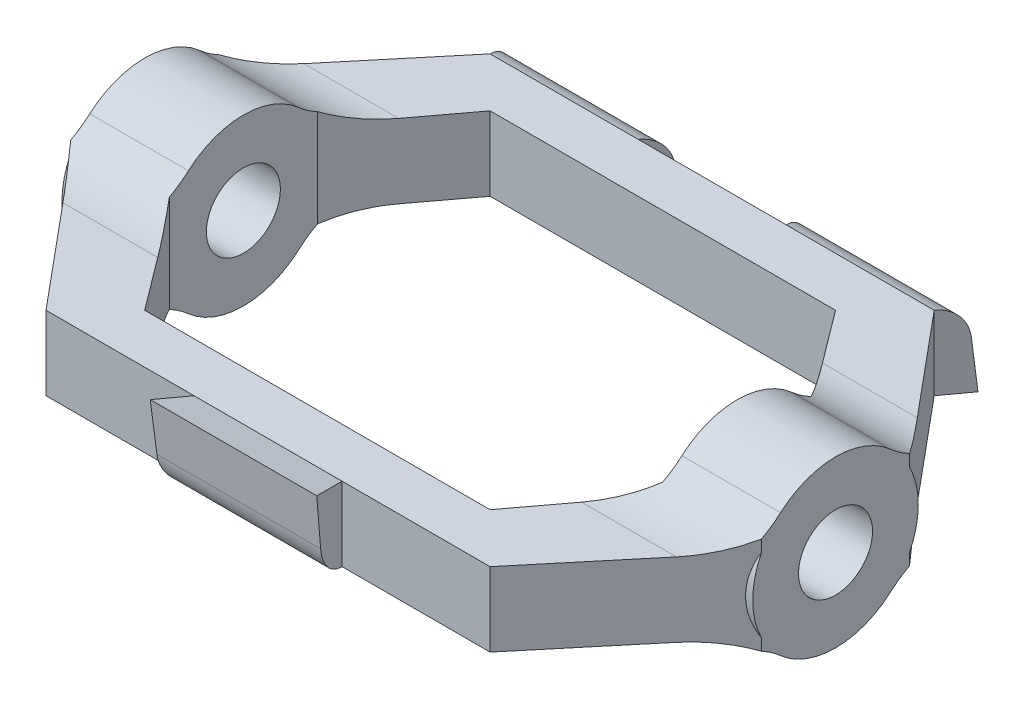
from build123d import *

# Parameters (mm, degrees)
RESSALTO_EXTRUS_O1_DEPTH           = 7.5
RESSALTO_EXTRUS_O1_2_DEPTH         = 7.5
ESBO_O2_R                          = 16.770509831
ESBO_O2_R_2                        = 7.5
RESSALTO_EXTRUS_O2_DEPTH           = 20
FILETE1_R                          = 20
ESBO_O3_W                          = 30
ESBO_O3_H                          = 15
RESSALTO_EXTRUS_O3_DEPTH           = 7
RESSALTO_EXTRUS_O3_DRAFT           = -15
ESBO_O4_W                          = 30
ESBO_O4_H                          = 15
RESSALTO_EXTRUS_O4_DEPTH           = 7
RESSALTO_EXTRUS_O4_DRAFT           = -15
RESSALTO_EXTRUS_O4_PROFILE_2_DEPTH = 7
RESSALTO_EXTRUS_O4_PROFILE_2_DRAFT = -15
CORTE_EXTRUS_O1_DEPTH              = 16.88
CORTE_EXTRUS_O2_DEPTH              = 46.88
FILETE4_R                          = 8


with BuildPart() as part:
    # Esboço1 → Ressalto-extrusão1 (new, symmetric)
    with BuildSketch(Plane(origin=(0, 0, 0), x_dir=(1, 0, 0), z_dir=(0, 1, 0))):
        Polygon((45, -45), (70, -15), (50, -15), (35, -35), (-35, -35), (-50, -15), (-70, -15), (-45, -45), align=None)
    extrude(amount=RESSALTO_EXTRUS_O1_DEPTH, both=True)



with BuildPart() as body_2:
    # Esboço1 → Ressalto-extrus_o1 2 (new, symmetric)
    with BuildSketch(Plane(origin=(0, 0, 0), x_dir=(1, 0, 0), z_dir=(0, 1, 0))):
        Polygon((70, 15), (50, 15), (35, 35), (-35, 35), (-50, 15), (-70, 15), (-45, 45), (45, 45), align=None)
    extrude(amount=RESSALTO_EXTRUS_O1_2_DEPTH, both=True)


with BuildPart() as part_1:
    add(part.part)

    add(body_2.part)  # Ressalto-extrusão2 merges body 2
    # Esboço2 → Ressalto-extrusão2 (add)
    with BuildSketch(Plane(origin=(-50, 0, 0), x_dir=(0, 0, -1), z_dir=(1, 0, 0))):
        Circle(ESBO_O2_R)
        Circle(ESBO_O2_R_2, mode=Mode.SUBTRACT)
    ressalto_extrus_o2 = extrude(amount=-RESSALTO_EXTRUS_O2_DEPTH)

    # Espelhar1: Ressalto-extrusão2 across plane
    add(ressalto_extrus_o2.mirror(Plane(origin=(0, 0, 0), x_dir=(0, 0, 1), z_dir=(1, 0, 0))))

    # Filete1
    # the kernel refuses this fillet: 20 mm, written as the material it adds along each edge
    with BuildSketch(Plane(origin=(70, -7.5, 15), x_dir=(0, 0, 1), z_dir=(-1, 0, 0))) as filete1_piece_1_section:
        with BuildLine():
            CenterArc((9.409432465, -20), FILETE1_R, 90, 41.59276394)
            ThreePointArc((-3.867202848, -5.042361324), (-1.692591399, -2.706021572), (0, 0))
            Line((0, 0), (9.409432465, 0))
        make_face()
    filete1_piece_1 = extrude(amount=20, mode=Mode.PRIVATE)
    filete1_piece_1 = split(filete1_piece_1, bisect_by=Plane(origin=(64.976467601, -8.579836869, 21.028238879), z_dir=(-0.7682212795973759, 0, -0.6401843996644799)), keep=Keep.TOP, mode=Mode.PRIVATE)
    filete1_piece_1 = split(filete1_piece_1, bisect_by=Plane(origin=(52.72088695, -8.579836869, 11.372150733), z_dir=(0.7999999999999996, 0, 0.6000000000000005)), keep=Keep.TOP, mode=Mode.PRIVATE)
    add(filete1_piece_1)
    with BuildSketch(Plane(origin=(70, -7.5, 15), x_dir=(0, 0, 1), z_dir=(-1, 0, 0))) as filete1_piece_2_section:
        with BuildLine():
            CenterArc((9.409432465, -20), FILETE1_R, 90, 41.59276394)
            ThreePointArc((-3.867202848, -5.042361324), (-1.692591399, -2.706021572), (0, 0))
            Line((0, 0), (9.409432465, 0))
        make_face()
    filete1_piece_2 = extrude(amount=20, mode=Mode.PRIVATE)
    filete1_piece_2 = split(filete1_piece_2, bisect_by=Plane(origin=(51.352262371, -10.660732835, 13.196983505), z_dir=(-0.7999999999999996, 0, -0.6000000000000005)), keep=Keep.TOP, mode=Mode.PRIVATE)
    add(filete1_piece_2)
    with BuildSketch(Plane(origin=(70, -7.5, 15), x_dir=(0, 0, 1), z_dir=(-1, 0, 0))) as filete1_piece_3_section:
        with BuildLine():
            CenterArc((9.409432465, -20), FILETE1_R, 90, 41.59276394)
            ThreePointArc((-3.867202848, -5.042361324), (-1.692591399, -2.706021572), (0, 0))
            Line((0, 0), (9.409432465, 0))
        make_face()
    filete1_piece_3 = extrude(amount=43.523581162, mode=Mode.PRIVATE)
    filete1_piece_3 = split(filete1_piece_3, bisect_by=Plane(origin=(46.899144186, -7.62078926, 19.134474419), z_dir=(0.7999999999999996, 0, 0.6000000000000005)), keep=Keep.TOP, mode=Mode.PRIVATE)
    filete1_piece_3 = split(filete1_piece_3, bisect_by=Plane(origin=(50, -7.62078926, 20.042041974), z_dir=(-1, 0, 0)), keep=Keep.TOP, mode=Mode.PRIVATE)
    add(filete1_piece_3)
    with BuildSketch(Plane(origin=(-26.476418838, 7.5, 15), x_dir=(0, 0.7935005396361219, -0.6085695470504449), z_dir=(-1, 0, 0))) as filete1_piece_4_section:
        with BuildLine():
            CenterArc((10.14371674, -19.637780679), FILETE1_R, 100.921092441, 41.59276394)
            Line((-5.726294053, -7.466389738), (0, 0))
            ThreePointArc((0, 0), (3.177289158, -0.303730134), (6.354578317, 0))
        make_face()
    filete1_piece_4 = extrude(amount=43.523581162, mode=Mode.PRIVATE)
    filete1_piece_4 = split(filete1_piece_4, bisect_by=Plane(origin=(-50, 7.62078926, 20.042041974), z_dir=(1, 0, 0)), keep=Keep.TOP, mode=Mode.PRIVATE)
    filete1_piece_4 = split(filete1_piece_4, bisect_by=Plane(origin=(-46.899144186, 7.62078926, 19.134474419), z_dir=(-0.7999999999999992, 0, 0.6000000000000011)), keep=Keep.TOP, mode=Mode.PRIVATE)
    add(filete1_piece_4)
    with BuildSketch(Plane(origin=(-50, 7.5, 15), x_dir=(0, 0.7935005396361215, -0.6085695470504452), z_dir=(-1, 0, 0))) as filete1_piece_5_section:
        with BuildLine():
            CenterArc((10.14371674, -19.637780679), FILETE1_R, 100.921092441, 41.59276394)
            Line((-5.726294053, -7.466389738), (0, 0))
            ThreePointArc((0, 0), (3.177289158, -0.303730134), (6.354578317, 0))
        make_face()
    filete1_piece_5 = extrude(amount=20, mode=Mode.PRIVATE)
    filete1_piece_5 = split(filete1_piece_5, bisect_by=Plane(origin=(-51.352262371, 10.660732835, 13.196983505), z_dir=(0.7999999999999992, 0, -0.6000000000000011)), keep=Keep.TOP, mode=Mode.PRIVATE)
    add(filete1_piece_5)
    with BuildSketch(Plane(origin=(-50, 7.5, 15), x_dir=(0, 0.7935005396361215, -0.6085695470504452), z_dir=(-1, 0, 0))) as filete1_piece_6_section:
        with BuildLine():
            CenterArc((10.14371674, -19.637780679), FILETE1_R, 100.921092441, 41.59276394)
            Line((-5.726294053, -7.466389738), (0, 0))
            ThreePointArc((0, 0), (3.177289158, -0.303730134), (6.354578317, 0))
        make_face()
    filete1_piece_6 = extrude(amount=20, mode=Mode.PRIVATE)
    filete1_piece_6 = split(filete1_piece_6, bisect_by=Plane(origin=(-64.976467601, 8.579836869, 21.028238879), z_dir=(0.7682212795973756, 0, -0.6401843996644802)), keep=Keep.TOP, mode=Mode.PRIVATE)
    filete1_piece_6 = split(filete1_piece_6, bisect_by=Plane(origin=(-52.72088695, 8.579836869, 11.372150733), z_dir=(-0.7999999999999992, 0, 0.6000000000000011)), keep=Keep.TOP, mode=Mode.PRIVATE)
    add(filete1_piece_6)
    with BuildSketch(Plane(origin=(70, 7.5, -15), x_dir=(0, 0.7935005396361229, 0.6085695470504434), z_dir=(-1, 0, 0))) as filete1_piece_7_section:
        with BuildLine():
            CenterArc((10.14371674, 19.637780679), FILETE1_R, 217.486143619, 41.59276394)
            Line((-5.726294053, 7.466389738), (0, 0))
            ThreePointArc((0, 0), (3.177289158, 0.303730134), (6.354578317, 0))
        make_face()
    filete1_piece_7 = extrude(amount=20, mode=Mode.PRIVATE)
    filete1_piece_7 = split(filete1_piece_7, bisect_by=Plane(origin=(52.72088695, 8.579836869, -11.372150733), z_dir=(0.7999999999999996, 0, -0.6000000000000005)), keep=Keep.TOP, mode=Mode.PRIVATE)
    filete1_piece_7 = split(filete1_piece_7, bisect_by=Plane(origin=(64.976467601, 8.579836869, -21.028238879), z_dir=(-0.7682212795973757, 0, 0.6401843996644802)), keep=Keep.TOP, mode=Mode.PRIVATE)
    add(filete1_piece_7)
    with BuildSketch(Plane(origin=(70, 7.5, -15), x_dir=(0, 0.7935005396361229, 0.6085695470504434), z_dir=(-1, 0, 0))) as filete1_piece_8_section:
        with BuildLine():
            CenterArc((10.14371674, 19.637780679), FILETE1_R, 217.486143619, 41.59276394)
            Line((-5.726294053, 7.466389738), (0, 0))
            ThreePointArc((0, 0), (3.177289158, 0.303730134), (6.354578317, 0))
        make_face()
    filete1_piece_8 = extrude(amount=43.523581162, mode=Mode.PRIVATE)
    filete1_piece_8 = split(filete1_piece_8, bisect_by=Plane(origin=(46.899144186, 7.62078926, -19.134474419), z_dir=(0.7999999999999996, 0, -0.6000000000000005)), keep=Keep.TOP, mode=Mode.PRIVATE)
    filete1_piece_8 = split(filete1_piece_8, bisect_by=Plane(origin=(50, 7.62078926, -20.042041974), z_dir=(-1, 0, 0)), keep=Keep.TOP, mode=Mode.PRIVATE)
    add(filete1_piece_8)
    with BuildSketch(Plane(origin=(70, 7.5, -15), x_dir=(0, 0.7935005396361229, 0.6085695470504434), z_dir=(-1, 0, 0))) as filete1_piece_9_section:
        with BuildLine():
            CenterArc((10.14371674, 19.637780679), FILETE1_R, 217.486143619, 41.59276394)
            Line((-5.726294053, 7.466389738), (0, 0))
            ThreePointArc((0, 0), (3.177289158, 0.303730134), (6.354578317, 0))
        make_face()
    filete1_piece_9 = extrude(amount=20, mode=Mode.PRIVATE)
    filete1_piece_9 = split(filete1_piece_9, bisect_by=Plane(origin=(51.352262371, 10.660732835, -13.196983505), z_dir=(-0.7999999999999996, 0, 0.6000000000000005)), keep=Keep.TOP, mode=Mode.PRIVATE)
    add(filete1_piece_9)
    with BuildSketch(Plane(origin=(-50, 7.5, -15), x_dir=(0, 0, -1), z_dir=(-1, 0, 0))) as filete1_piece_10_section:
        with BuildLine():
            CenterArc((9.409432465, -20), FILETE1_R, 90, 41.59276394)
            ThreePointArc((-3.867202848, -5.042361324), (-1.692591399, -2.706021572), (0, 0))
            Line((0, 0), (9.409432465, 0))
        make_face()
    filete1_piece_10 = extrude(amount=20, mode=Mode.PRIVATE)
    filete1_piece_10 = split(filete1_piece_10, bisect_by=Plane(origin=(-51.352262371, 10.660732835, -13.196983505), z_dir=(0.7999999999999999, 0, 0.6000000000000002)), keep=Keep.TOP, mode=Mode.PRIVATE)
    add(filete1_piece_10)
    with BuildSketch(Plane(origin=(-26.476418838, 7.5, -15), x_dir=(0, 0, -1), z_dir=(-1, 0, 0))) as filete1_piece_11_section:
        with BuildLine():
            CenterArc((9.409432465, -20), FILETE1_R, 90, 41.59276394)
            ThreePointArc((-3.867202848, -5.042361324), (-1.692591399, -2.706021572), (0, 0))
            Line((0, 0), (9.409432465, 0))
        make_face()
    filete1_piece_11 = extrude(amount=43.523581162, mode=Mode.PRIVATE)
    filete1_piece_11 = split(filete1_piece_11, bisect_by=Plane(origin=(-50, 7.62078926, -20.042041974), z_dir=(1, 0, 0)), keep=Keep.TOP, mode=Mode.PRIVATE)
    filete1_piece_11 = split(filete1_piece_11, bisect_by=Plane(origin=(-46.899144186, 7.62078926, -19.134474419), z_dir=(-0.7999999999999999, 0, -0.6000000000000002)), keep=Keep.TOP, mode=Mode.PRIVATE)
    add(filete1_piece_11)
    with BuildSketch(Plane(origin=(-50, 7.5, -15), x_dir=(0, 0, -1), z_dir=(-1, 0, 0))) as filete1_piece_12_section:
        with BuildLine():
            CenterArc((9.409432465, -20), FILETE1_R, 90, 41.59276394)
            ThreePointArc((-3.867202848, -5.042361324), (-1.692591399, -2.706021572), (0, 0))
            Line((0, 0), (9.409432465, 0))
        make_face()
    filete1_piece_12 = extrude(amount=20, mode=Mode.PRIVATE)
    filete1_piece_12 = split(filete1_piece_12, bisect_by=Plane(origin=(-52.72088695, 8.579836869, -11.372150733), z_dir=(-0.7999999999999999, 0, -0.6000000000000002)), keep=Keep.TOP, mode=Mode.PRIVATE)
    filete1_piece_12 = split(filete1_piece_12, bisect_by=Plane(origin=(-64.976467601, 8.579836869, -21.028238879), z_dir=(0.7682212795973755, 0, 0.6401843996644803)), keep=Keep.TOP, mode=Mode.PRIVATE)
    add(filete1_piece_12)
    with BuildSketch(Plane(origin=(70, -7.5, -15), x_dir=(0, 0, -1), z_dir=(-1, 0, 0))) as filete1_piece_13_section:
        with BuildLine():
            CenterArc((9.409432465, 20), FILETE1_R, 228.40723606, 41.59276394)
            ThreePointArc((-3.867202848, 5.042361324), (-1.692591399, 2.706021572), (0, 0))
            Line((0, 0), (9.409432465, 0))
        make_face()
    filete1_piece_13 = extrude(amount=20, mode=Mode.PRIVATE)
    filete1_piece_13 = split(filete1_piece_13, bisect_by=Plane(origin=(52.72088695, -8.579836869, -11.372150733), z_dir=(0.7999999999999996, 0, -0.6000000000000005)), keep=Keep.TOP, mode=Mode.PRIVATE)
    filete1_piece_13 = split(filete1_piece_13, bisect_by=Plane(origin=(64.976467601, -8.579836869, -21.028238879), z_dir=(-0.7682212795973757, 0, 0.6401843996644802)), keep=Keep.TOP, mode=Mode.PRIVATE)
    add(filete1_piece_13)
    with BuildSketch(Plane(origin=(70, -7.5, -15), x_dir=(0, 0, -1), z_dir=(-1, 0, 0))) as filete1_piece_14_section:
        with BuildLine():
            CenterArc((9.409432465, 20), FILETE1_R, 228.40723606, 41.59276394)
            ThreePointArc((-3.867202848, 5.042361324), (-1.692591399, 2.706021572), (0, 0))
            Line((0, 0), (9.409432465, 0))
        make_face()
    filete1_piece_14 = extrude(amount=20, mode=Mode.PRIVATE)
    filete1_piece_14 = split(filete1_piece_14, bisect_by=Plane(origin=(51.352262371, -10.660732835, -13.196983505), z_dir=(-0.7999999999999996, 0, 0.6000000000000005)), keep=Keep.TOP, mode=Mode.PRIVATE)
    add(filete1_piece_14)
    with BuildSketch(Plane(origin=(70, -7.5, -15), x_dir=(0, 0, -1), z_dir=(-1, 0, 0))) as filete1_piece_15_section:
        with BuildLine():
            CenterArc((9.409432465, 20), FILETE1_R, 228.40723606, 41.59276394)
            ThreePointArc((-3.867202848, 5.042361324), (-1.692591399, 2.706021572), (0, 0))
            Line((0, 0), (9.409432465, 0))
        make_face()
    filete1_piece_15 = extrude(amount=43.523581162, mode=Mode.PRIVATE)
    filete1_piece_15 = split(filete1_piece_15, bisect_by=Plane(origin=(46.899144186, -7.62078926, -19.134474419), z_dir=(0.7999999999999996, 0, -0.6000000000000005)), keep=Keep.TOP, mode=Mode.PRIVATE)
    filete1_piece_15 = split(filete1_piece_15, bisect_by=Plane(origin=(50, -7.62078926, -20.042041974), z_dir=(-1, 0, 0)), keep=Keep.TOP, mode=Mode.PRIVATE)
    add(filete1_piece_15)
    with BuildSketch(Plane(origin=(-50, -7.5, -15), x_dir=(0, 0, -1), z_dir=(-1, 0, 0))) as filete1_piece_16_section:
        with BuildLine():
            CenterArc((9.409432465, 20), FILETE1_R, 228.40723606, 41.59276394)
            ThreePointArc((-3.867202848, 5.042361324), (-1.692591399, 2.706021572), (0, 0))
            Line((0, 0), (9.409432465, 0))
        make_face()
    filete1_piece_16 = extrude(amount=20, mode=Mode.PRIVATE)
    filete1_piece_16 = split(filete1_piece_16, bisect_by=Plane(origin=(-51.352262371, -10.660732835, -13.196983505), z_dir=(0.7999999999999999, 0, 0.6000000000000002)), keep=Keep.TOP, mode=Mode.PRIVATE)
    add(filete1_piece_16)
    with BuildSketch(Plane(origin=(-26.476418838, -7.5, -15), x_dir=(0, 0, -1), z_dir=(-1, 0, 0))) as filete1_piece_17_section:
        with BuildLine():
            CenterArc((9.409432465, 20), FILETE1_R, 228.40723606, 41.59276394)
            ThreePointArc((-3.867202848, 5.042361324), (-1.692591399, 2.706021572), (0, 0))
            Line((0, 0), (9.409432465, 0))
        make_face()
    filete1_piece_17 = extrude(amount=43.523581162, mode=Mode.PRIVATE)
    filete1_piece_17 = split(filete1_piece_17, bisect_by=Plane(origin=(-50, -7.62078926, -20.042041974), z_dir=(1, 0, 0)), keep=Keep.TOP, mode=Mode.PRIVATE)
    filete1_piece_17 = split(filete1_piece_17, bisect_by=Plane(origin=(-46.899144186, -7.62078926, -19.134474419), z_dir=(-0.7999999999999999, 0, -0.6000000000000002)), keep=Keep.TOP, mode=Mode.PRIVATE)
    add(filete1_piece_17)
    with BuildSketch(Plane(origin=(-50, -7.5, -15), x_dir=(0, 0, -1), z_dir=(-1, 0, 0))) as filete1_piece_18_section:
        with BuildLine():
            CenterArc((9.409432465, 20), FILETE1_R, 228.40723606, 41.59276394)
            ThreePointArc((-3.867202848, 5.042361324), (-1.692591399, 2.706021572), (0, 0))
            Line((0, 0), (9.409432465, 0))
        make_face()
    filete1_piece_18 = extrude(amount=20, mode=Mode.PRIVATE)
    filete1_piece_18 = split(filete1_piece_18, bisect_by=Plane(origin=(-52.72088695, -8.579836869, -11.372150733), z_dir=(-0.7999999999999999, 0, -0.6000000000000002)), keep=Keep.TOP, mode=Mode.PRIVATE)
    filete1_piece_18 = split(filete1_piece_18, bisect_by=Plane(origin=(-64.976467601, -8.579836869, -21.028238879), z_dir=(0.7682212795973755, 0, 0.6401843996644803)), keep=Keep.TOP, mode=Mode.PRIVATE)
    add(filete1_piece_18)
    with BuildSketch(Plane(origin=(70, 7.5, 15), x_dir=(0, 0.7935005396361229, -0.6085695470504434), z_dir=(-1, 0, 0))) as filete1_piece_19_section:
        with BuildLine():
            CenterArc((10.14371674, -19.637780679), FILETE1_R, 100.921092441, 41.59276394)
            Line((-5.726294053, -7.466389738), (0, 0))
            ThreePointArc((0, 0), (3.177289158, -0.303730134), (6.354578317, 0))
        make_face()
    filete1_piece_19 = extrude(amount=20, mode=Mode.PRIVATE)
    filete1_piece_19 = split(filete1_piece_19, bisect_by=Plane(origin=(64.976467601, 8.579836869, 21.028238879), z_dir=(-0.7682212795973759, 0, -0.6401843996644799)), keep=Keep.TOP, mode=Mode.PRIVATE)
    filete1_piece_19 = split(filete1_piece_19, bisect_by=Plane(origin=(52.72088695, 8.579836869, 11.372150733), z_dir=(0.7999999999999996, 0, 0.6000000000000005)), keep=Keep.TOP, mode=Mode.PRIVATE)
    add(filete1_piece_19)
    with BuildSketch(Plane(origin=(70, 7.5, 15), x_dir=(0, 0.7935005396361229, -0.6085695470504434), z_dir=(-1, 0, 0))) as filete1_piece_20_section:
        with BuildLine():
            CenterArc((10.14371674, -19.637780679), FILETE1_R, 100.921092441, 41.59276394)
            Line((-5.726294053, -7.466389738), (0, 0))
            ThreePointArc((0, 0), (3.177289158, -0.303730134), (6.354578317, 0))
        make_face()
    filete1_piece_20 = extrude(amount=43.523581162, mode=Mode.PRIVATE)
    filete1_piece_20 = split(filete1_piece_20, bisect_by=Plane(origin=(50, 7.62078926, 20.042041974), z_dir=(-1, 0, 0)), keep=Keep.TOP, mode=Mode.PRIVATE)
    filete1_piece_20 = split(filete1_piece_20, bisect_by=Plane(origin=(46.899144186, 7.62078926, 19.134474419), z_dir=(0.7999999999999996, 0, 0.6000000000000005)), keep=Keep.TOP, mode=Mode.PRIVATE)
    add(filete1_piece_20)
    with BuildSketch(Plane(origin=(70, 7.5, 15), x_dir=(0, 0.7935005396361229, -0.6085695470504434), z_dir=(-1, 0, 0))) as filete1_piece_21_section:
        with BuildLine():
            CenterArc((10.14371674, -19.637780679), FILETE1_R, 100.921092441, 41.59276394)
            Line((-5.726294053, -7.466389738), (0, 0))
            ThreePointArc((0, 0), (3.177289158, -0.303730134), (6.354578317, 0))
        make_face()
    filete1_piece_21 = extrude(amount=20, mode=Mode.PRIVATE)
    filete1_piece_21 = split(filete1_piece_21, bisect_by=Plane(origin=(51.352262371, 10.660732835, 13.196983505), z_dir=(-0.7999999999999996, 0, -0.6000000000000005)), keep=Keep.TOP, mode=Mode.PRIVATE)
    add(filete1_piece_21)
    with BuildSketch(Plane(origin=(-50, -7.5, 15), x_dir=(0, 0, 1), z_dir=(-1, 0, 0))) as filete1_piece_22_section:
        with BuildLine():
            CenterArc((9.409432465, -20), FILETE1_R, 90, 41.59276394)
            ThreePointArc((-3.867202848, -5.042361324), (-1.692591399, -2.706021572), (0, 0))
            Line((0, 0), (9.409432465, 0))
        make_face()
    filete1_piece_22 = extrude(amount=20, mode=Mode.PRIVATE)
    filete1_piece_22 = split(filete1_piece_22, bisect_by=Plane(origin=(-51.352262371, -10.660732835, 13.196983505), z_dir=(0.7999999999999992, 0, -0.6000000000000011)), keep=Keep.TOP, mode=Mode.PRIVATE)
    add(filete1_piece_22)
    with BuildSketch(Plane(origin=(-26.476418838, -7.5, 15), x_dir=(0, 0, 1), z_dir=(-1, 0, 0))) as filete1_piece_23_section:
        with BuildLine():
            CenterArc((9.409432465, -20), FILETE1_R, 90, 41.59276394)
            ThreePointArc((-3.867202848, -5.042361324), (-1.692591399, -2.706021572), (0, 0))
            Line((0, 0), (9.409432465, 0))
        make_face()
    filete1_piece_23 = extrude(amount=43.523581162, mode=Mode.PRIVATE)
    filete1_piece_23 = split(filete1_piece_23, bisect_by=Plane(origin=(-46.899144186, -7.62078926, 19.134474419), z_dir=(-0.7999999999999992, 0, 0.6000000000000011)), keep=Keep.TOP, mode=Mode.PRIVATE)
    filete1_piece_23 = split(filete1_piece_23, bisect_by=Plane(origin=(-50, -7.62078926, 20.042041974), z_dir=(1, 0, 0)), keep=Keep.TOP, mode=Mode.PRIVATE)
    add(filete1_piece_23)
    with BuildSketch(Plane(origin=(-50, -7.5, 15), x_dir=(0, 0, 1), z_dir=(-1, 0, 0))) as filete1_piece_24_section:
        with BuildLine():
            CenterArc((9.409432465, -20), FILETE1_R, 90, 41.59276394)
            ThreePointArc((-3.867202848, -5.042361324), (-1.692591399, -2.706021572), (0, 0))
            Line((0, 0), (9.409432465, 0))
        make_face()
    filete1_piece_24 = extrude(amount=20, mode=Mode.PRIVATE)
    filete1_piece_24 = split(filete1_piece_24, bisect_by=Plane(origin=(-52.72088695, -8.579836869, 11.372150733), z_dir=(-0.7999999999999992, 0, 0.6000000000000011)), keep=Keep.TOP, mode=Mode.PRIVATE)
    filete1_piece_24 = split(filete1_piece_24, bisect_by=Plane(origin=(-64.976467601, -8.579836869, 21.028238879), z_dir=(0.7682212795973756, 0, -0.6401843996644802)), keep=Keep.TOP, mode=Mode.PRIVATE)
    add(filete1_piece_24)


with BuildPart() as ressalto_extrus_o3_tool:
    # Esboço3 → Ressalto-extrusão3 (with draft: the straight prism first)
    with BuildSketch(Plane.XY.offset(45)):
        Rectangle(ESBO_O3_W, ESBO_O3_H)
    extrude(amount=RESSALTO_EXTRUS_O3_DEPTH)
    # Ressalto-extrusão3: the draft: its side faces are tilted about the plane it starts from
    ressalto_extrus_o3_sides = [ressalto_extrus_o3_tool.faces().sort_by_distance(p)[0] for p in [
        (0, -7.5, 48.5),
        (15, 0, 48.5),
        (0, 7.5, 48.5),
        (-15, 0, 48.5),
    ]]
    draft(ressalto_extrus_o3_sides, Plane.XY.offset(45), RESSALTO_EXTRUS_O3_DRAFT)


with BuildPart() as part_2:
    add(part_1.part)

    # Ressalto-extrusão3: add ressalto_extrus_o3_tool
    add(ressalto_extrus_o3_tool.part)


with BuildPart() as ressalto_extrus_o4_tool:
    # Esboço4 → Ressalto-extrusão4 (with draft: the straight prism first)
    with BuildSketch(Plane(origin=(0, 0, -45), x_dir=(-1, 0, 0), z_dir=(0, 0, -1))):
        with Locations((-30, 0)):
            Rectangle(ESBO_O4_W, ESBO_O4_H)
    extrude(amount=RESSALTO_EXTRUS_O4_DEPTH)
    # Ressalto-extrusão4: the draft: its side faces are tilted about the plane it starts from
    ressalto_extrus_o4_sides = [ressalto_extrus_o4_tool.faces().sort_by_distance(p)[0] for p in [
        (45, 0, -48.5),
        (30, -7.5, -48.5),
        (15, 0, -48.5),
        (30, 7.5, -48.5),
    ]]
    draft(ressalto_extrus_o4_sides, Plane(origin=(0, 0, -45), x_dir=(-1, 0, 0), z_dir=(0, 0, -1)), RESSALTO_EXTRUS_O4_DRAFT)


with BuildPart() as part_3:
    add(part_2.part)

    # Ressalto-extrusão4: add ressalto_extrus_o4_tool
    add(ressalto_extrus_o4_tool.part)


with BuildPart() as ressalto_extrus_o4_profile_2_tool:
    # Esboço4 → Ressalto-extrusão4 profile 2 (with draft: the straight prism first)
    with BuildSketch(Plane(origin=(0, 0, -45), x_dir=(-1, 0, 0), z_dir=(0, 0, -1))):
        with Locations((30, 0)):
            Rectangle(ESBO_O4_W, ESBO_O4_H)
    extrude(amount=RESSALTO_EXTRUS_O4_PROFILE_2_DEPTH)
    # Ressalto-extrusão4 profile 2: the draft: its side faces are tilted about the plane it starts from
    ressalto_extrus_o4_profile_2_sides = [ressalto_extrus_o4_profile_2_tool.faces().sort_by_distance(p)[0] for p in [
        (-15, 0, -48.5),
        (-30, -7.5, -48.5),
        (-45, 0, -48.5),
        (-30, 7.5, -48.5),
    ]]
    draft(ressalto_extrus_o4_profile_2_sides, Plane(origin=(0, 0, -45), x_dir=(-1, 0, 0), z_dir=(0, 0, -1)), RESSALTO_EXTRUS_O4_PROFILE_2_DRAFT)


with BuildPart() as part_4:
    add(part_3.part)

    # Ressalto-extrusão4 profile 2: add ressalto_extrus_o4_profile_2_tool
    add(ressalto_extrus_o4_profile_2_tool.part)

    # Esboço8 → Corte-extrusão1 (cut, symmetric)
    with BuildSketch(Plane(origin=(0, 0, 0), x_dir=(0, 0, -1), z_dir=(1, 0, 0))):
        Polygon((-52, 9.375644347), (-50.055570404, -8.854636007), (-52, -9.375644347), align=None)
    extrude(amount=CORTE_EXTRUS_O1_DEPTH, both=True, mode=Mode.SUBTRACT)

    # Esboço7 → Corte-extrusão2 (cut, symmetric)
    with BuildSketch(Plane(origin=(0, 0, 0), x_dir=(0, 0, -1), z_dir=(1, 0, 0))):
        Polygon((52, 9.375644347), (52, -9.375644347), (50.055570404, 8.854636007), align=None)
    extrude(amount=CORTE_EXTRUS_O2_DEPTH, both=True, mode=Mode.SUBTRACT)

    # Filete4
    # the kernel refuses this fillet: 8 mm, written as the material it takes off along each edge
    with BuildSketch(Plane(origin=(37.089156252, -8.854636007, 50.055570404), x_dir=(0, 0.2588190451025214, -0.9659258262890682), z_dir=(-1, 0, 0))) as filete4_piece_1:
        with BuildLine():
            CenterArc((9.188260198, -6.954360309), FILETE4_R, 119.623178498, 69.288708643)
            Line((1.284838224, -8.193683147), (1.126769784, -8.218469603))
            Line((1.126769784, -8.218469603), (-0.158068439, -0.024786457))
            Line((-0.158068439, -0.024786457), (0, 0.16))
            ThreePointArc((0, 0.16), (2.616955809, 0.16), (5.154824646, 0.139087206))
            Line((5.154824646, 0.139087206), (5.233911617, 0))
        make_face()
    extrude(amount=74.178312504, mode=Mode.SUBTRACT)
    with BuildSketch(Plane(origin=(-7.089156252, 8.854636007, -50.055570404), x_dir=(0, -0.25881904510252035, 0.9659258262890684), z_dir=(1, 0, 0)), Plane(origin=(-67.089156252, 8.854636007, -50.055570404), x_dir=(0, -0.2588190451025244, 0.9659258262890674), z_dir=(1, 0, 0))) as filete4_piece_2:
        with BuildLine():
            CenterArc((9.188260198, 6.954360309), FILETE4_R, 171.088112859, 69.288708643)
            Line((1.284838224, 8.193683147), (1.126769784, 8.218469603))
            Line((1.126769784, 8.218469603), (-0.158068439, 0.024786457))
            Line((-0.158068439, 0.024786457), (0, -0.16))
            ThreePointArc((0, -0.16), (2.616955809, -0.16), (5.154824646, -0.139087206))
            Line((5.154824646, -0.139087206), (5.233911617, 0))
        make_face()
    extrude(amount=74.178312504, mode=Mode.SUBTRACT)


solid = part_4.part
